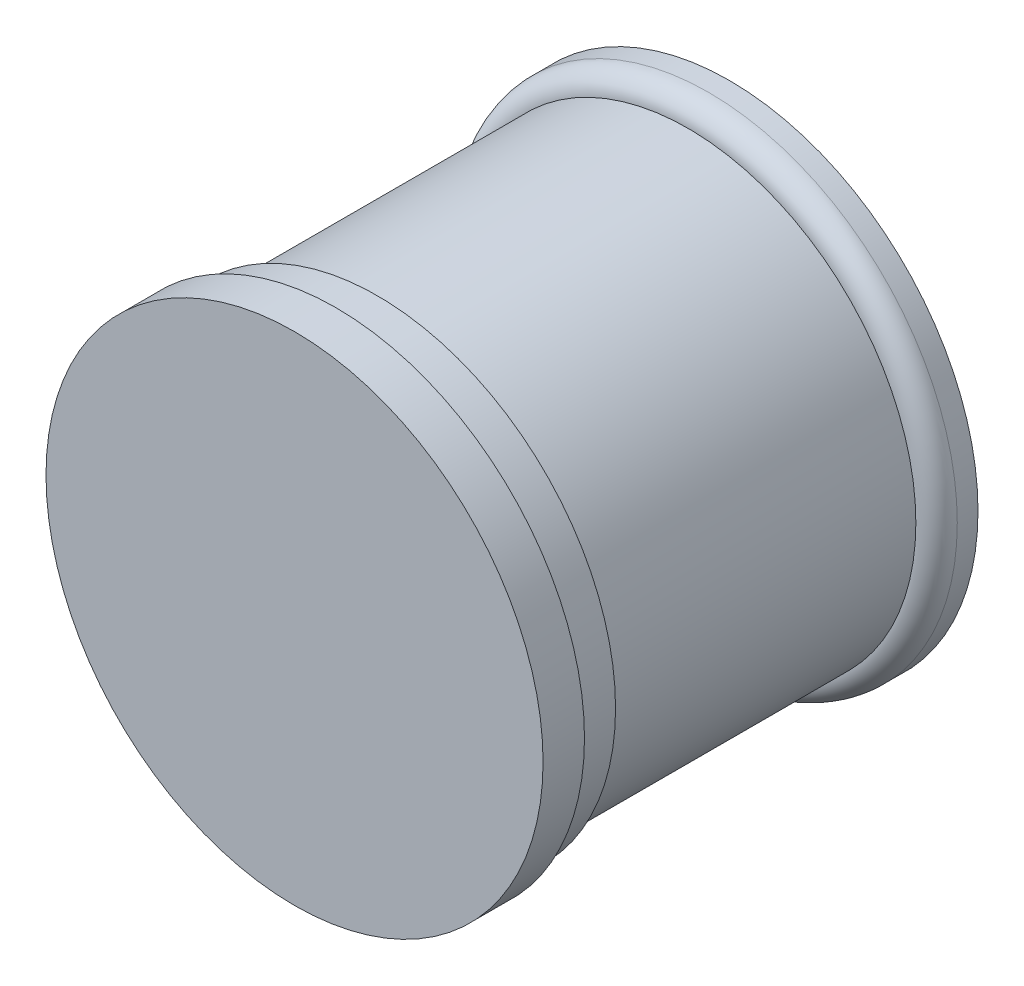
from build123d import *

# Parameters (mm, degrees)
SKETCH2_R           = 600
BOSS_EXTRUDE1_DEPTH = 100
SKETCH3_R           = 550
BOSS_EXTRUDE2_DEPTH = 750
FILLET1_R           = 50
SKETCH4_R           = 575
BOSS_EXTRUDE3_DEPTH = 100
SKETCH5_R           = 600
BOSS_EXTRUDE4_DEPTH = 100


with BuildPart() as part:
    # Sketch2 → Boss-Extrude1 (new body)
    with BuildSketch(Plane.XY):
        Circle(SKETCH2_R)
    extrude(amount=BOSS_EXTRUDE1_DEPTH)

    # Sketch3 → Boss-Extrude2 (add)
    with BuildSketch(Plane.XY.offset(100)):
        Circle(SKETCH3_R)
    extrude(amount=BOSS_EXTRUDE2_DEPTH)

    # Fillet1
    fillet1_edges = [part.edges().sort_by_distance(p)[0] for p in [
        (-600, 0, 100),
    ]]
    fillet(fillet1_edges, radius=FILLET1_R - 0.0001)  # a hair under: the kernel refuses the full size

    # Sketch4 → Boss-Extrude3 (add)
    with BuildSketch(Plane.XY.offset(850)):
        Circle(SKETCH4_R)
    extrude(amount=BOSS_EXTRUDE3_DEPTH)

    # Sketch5 → Boss-Extrude4 (add)
    with BuildSketch(Plane.XY.offset(950)):
        Circle(SKETCH5_R)
    extrude(amount=BOSS_EXTRUDE4_DEPTH)


solid = part.part
